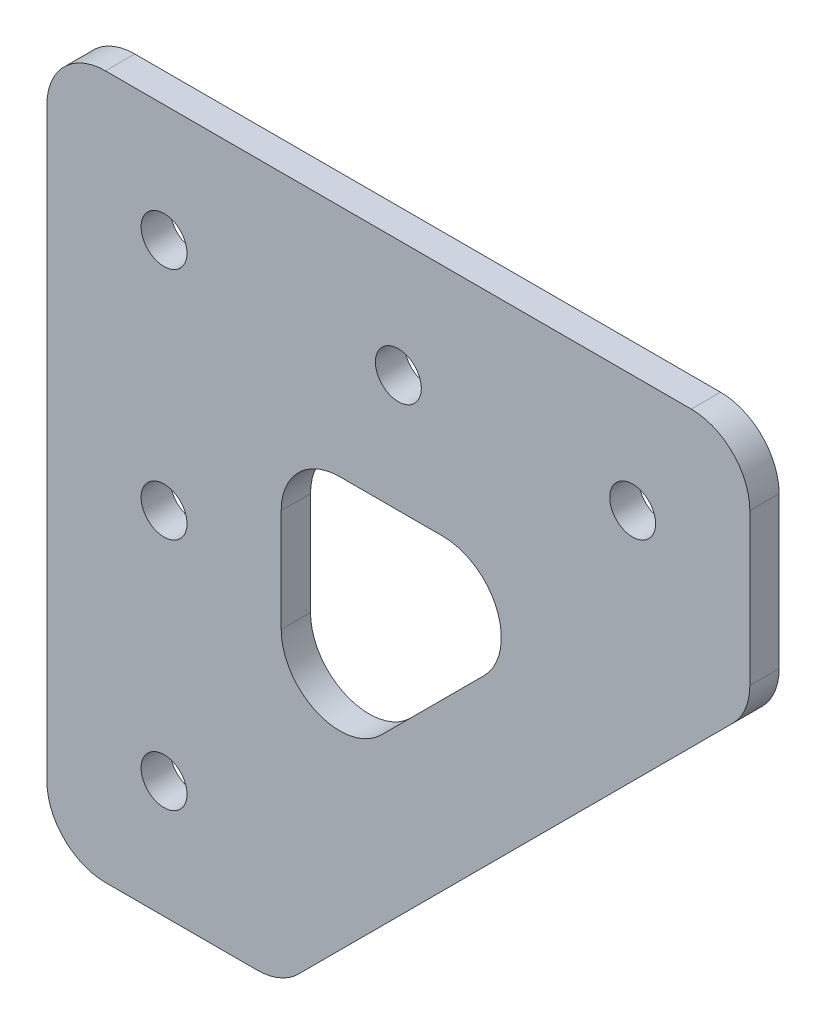
from build123d import *

# Parameters (mm, degrees)
BOSS_EXTRUDE1_DEPTH = 3.175
SKETCH2_R           = 2.4892
CUT_EXTRUDE1_DEPTH  = 108.809835474
FILLET3_R           = 6.35


with BuildPart() as part:
    # Sketch1 → Boss-Extrude1 (new body)
    with BuildSketch(Plane.XY):
        Polygon((0, 76.2), (0, 0), (25.4, 0), (76.2, 50.8), (76.2, 76.2), align=None)
        Polygon((25.4, 50.8), (58.239487758, 50.8), (25.4, 17.960512242), align=None, mode=Mode.SUBTRACT)
    extrude(amount=-BOSS_EXTRUDE1_DEPTH)

    # Sketch2 → Cut-Extrude1 (cut, through all)
    with BuildSketch(Plane.XY):
        with Locations((12.7, 63.5)):
            Circle(SKETCH2_R)
        with Locations((38.1, 63.5)):
            Circle(SKETCH2_R)
        with Locations((63.5, 63.5)):
            Circle(SKETCH2_R)
        with Locations((12.7, 38.1)):
            Circle(SKETCH2_R)
        with Locations((12.7, 12.7)):
            Circle(SKETCH2_R)
    extrude(amount=-CUT_EXTRUDE1_DEPTH, mode=Mode.SUBTRACT)

    # Fillet3
    fillet3_edges = [part.edges().sort_by_distance(p)[0] for p in [
        (58.239487758, 50.8, -1.5875),
        (25.4, 17.960512242, -1.5875),
        (25.4, 50.8, -1.5875),
        (25.4, 0, -1.5875),
        (76.2, 50.8, -1.5875),
        (76.2, 76.2, -1.5875),
        (0, 0, -1.5875),
        (0, 76.2, -1.5875),
    ]]
    fillet(fillet3_edges, radius=FILLET3_R)


solid = part.part
